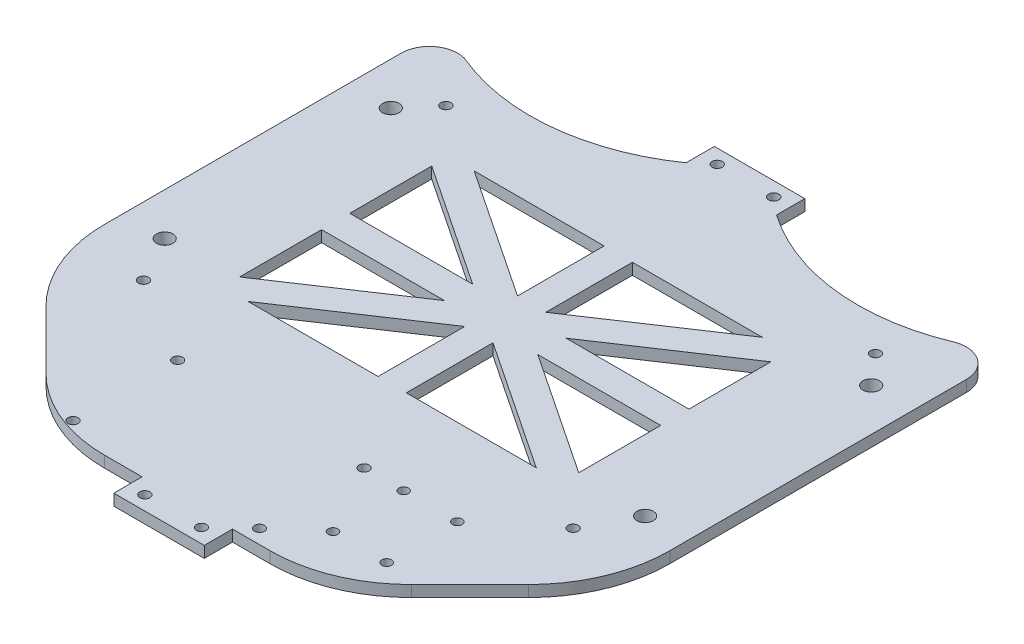
from build123d import *

# Parameters (mm, degrees)
BOSS_EXTRUDE1_DEPTH      = 4
M5_CLEARANCE_HOLE1_D     = 5.8
FILLET1_R                = 10
M3_CLEARANCE_HOLE1_D     = 3.6
M3_CLEARANCE_HOLE1_DEPTH = 10
M3_CLEARANCE_HOLE1_TIP   = 1.081549114
CHAMFER1_SIZE            = 50
FILLET3_R                = 50
M3_CLEARANCE_HOLE2_D     = 3.6
M3_CLEARANCE_HOLE3_D     = 3.4


with BuildPart() as part:
    # Sketch1 → Boss-Extrude1 (new body)
    with BuildSketch(Plane(origin=(0, 0, 0), x_dir=(1, 0, 0), z_dir=(0, 1, 0))):
        with BuildLine():
            Line((-100, -29.5), (-100, -222))
            Line((-100, -222), (-16, -222))
            Line((-16, -222), (-16, -232))
            Line((-16, -232), (16, -232))
            Line((16, -232), (16, -222))
            Line((16, -222), (100, -222))
            Line((100, -222), (100, -29.5))
            ThreePointArc((100, -29.5), (58, -42.739333694), (16, -29.5))
            Line((16, -29.5), (16, -19.5))
            Line((16, -19.5), (-16, -19.5))
            Line((-16, -19.5), (-16, -29.5))
            ThreePointArc((-16, -29.5), (-58, -42.739333694), (-100, -29.5))
        make_face()
        Polygon((-60, -143.490747874), (-60, -114.5), (-16.513878189, -114.5), align=None, mode=Mode.SUBTRACT)
        Polygon((-5, -149.5), (-50.986121811, -149.5), (-5, -118.842585459), align=None, mode=Mode.SUBTRACT)
        Polygon((50.986121811, -149.5), (5, -149.5), (5, -118.842585459), align=None, mode=Mode.SUBTRACT)
        Polygon((60, -114.5), (60, -143.490747874), (16.513878189, -114.5), align=None, mode=Mode.SUBTRACT)
        Polygon((60, -75.509252126), (60, -104.5), (16.513878189, -104.5), align=None, mode=Mode.SUBTRACT)
        Polygon((5, -69.5), (50.986121811, -69.5), (5, -100.157414541), align=None, mode=Mode.SUBTRACT)
        Polygon((-50.986121811, -69.5), (-5, -69.5), (-5, -100.157414541), align=None, mode=Mode.SUBTRACT)
        Polygon((-60, -104.5), (-60, -75.509252126), (-16.513878189, -104.5), align=None, mode=Mode.SUBTRACT)
    extrude(amount=BOSS_EXTRUDE1_DEPTH)

    # M5 Clearance Hole1 (through all)
    with Locations(Plane(origin=(0, 4, 0), x_dir=(1, 0, 0), z_dir=(0, 1, 0))):
        with Locations((-85, -65), (-85, -145), (85, -145), (85, -65)):
            Hole(M5_CLEARANCE_HOLE1_D / 2)

    # Fillet1
    fillet1_edges = [part.edges().sort_by_distance(p)[0] for p in [
        (100, 2, 29.5),
        (-100, 2, 29.5),
    ]]
    fillet(fillet1_edges, radius=FILLET1_R)

    # M3 Clearance Hole1
    with Locations(Plane(origin=(0, 4, 0), x_dir=(1, 0, 0), z_dir=(0, 1, 0))):
        with Locations((-45.45, -217), (-45.45, -180), (20.55, -180), (20.55, -217)):
            Hole(M3_CLEARANCE_HOLE1_D / 2, depth=M3_CLEARANCE_HOLE1_DEPTH)
            with Locations((0, 0, -(M3_CLEARANCE_HOLE1_DEPTH + M3_CLEARANCE_HOLE1_TIP / 2))):  # 118° drill point
                Cone(0, M3_CLEARANCE_HOLE1_D / 2, M3_CLEARANCE_HOLE1_TIP, mode=Mode.SUBTRACT)

    # Chamfer1
    chamfer1_edges = [part.edges().sort_by_distance(p)[0] for p in [
        (100, 2, 222),
        (-100, 2, 222),
    ]]
    chamfer(chamfer1_edges, length=CHAMFER1_SIZE)

    # Fillet3
    fillet3_edges = [part.edges().sort_by_distance(p)[0] for p in [
        (-100, 2, 172),
        (-50, 2, 222),
        (100, 2, 172),
        (50, 2, 222),
    ]]
    fillet(fillet3_edges, radius=FILLET3_R)

    # M3 Clearance Hole2 (through all)
    with Locations(Plane(origin=(0, 4, 0), x_dir=(1, 0, 0), z_dir=(0, 1, 0))):
        with Locations((-76, -54.5), (76, -54.5), (76, -161.5), (-76, -161.5), (-10, -24.5), (10, -24.5), (-10, -227), (10, -227)):
            Hole(M3_CLEARANCE_HOLE2_D / 2)

    # M3 Clearance Hole3 (through all)
    with Locations(Plane(origin=(0, 4, 0), x_dir=(1, 0, 0), z_dir=(0, 1, 0))):
        with Locations((53.55, -180), (34.55, -180), (34.55, -205), (53.55, -205)):
            Hole(M3_CLEARANCE_HOLE3_D / 2)


solid = part.part
